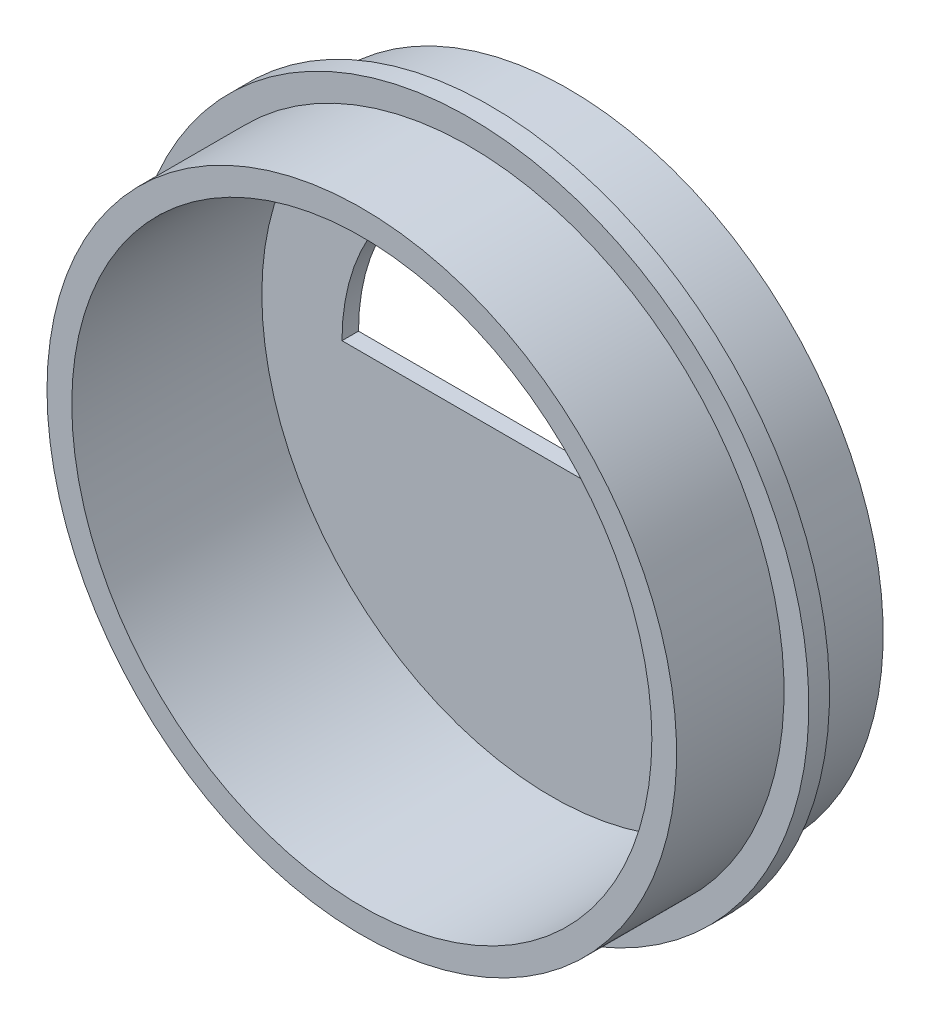
from build123d import *

# Parameters (mm, degrees)
BOSS_EXTRUDE1_START = -2
BOSS_EXTRUDE1_DEPTH = 2


with BuildPart() as part:
    # Sketch6 → Revolve1 (revolve)
    with BuildSketch(Plane(origin=(0, 0, 0), x_dir=(0, 0, -1), z_dir=(1, 0, 0))):
        Polygon((0, 25.4), (-2, 25.4), (-2, 35.1), (-25, 35.1), (-25, 38.1), (-12, 38.1), (-12, 41.1), (-9.5, 41.1), (-9.5, 38.1), (0, 38.1), align=None)
    revolve(axis=Axis((0, 0, 0), (0, 0, 1)))

    # Sketch7 → Boss-Extrude1 (add)
    with BuildSketch(Plane(origin=(0, 0, 0), x_dir=(-1, 0, 0), z_dir=(0, 0, -1)).offset(BOSS_EXTRUDE1_START)):
        with BuildLine():
            Line((-25.4, 0), (25.4, 0))
            ThreePointArc((25.4, 0), (0, -25.4), (-25.4, 0))
        make_face()
    extrude(amount=BOSS_EXTRUDE1_DEPTH)


solid = part.part
